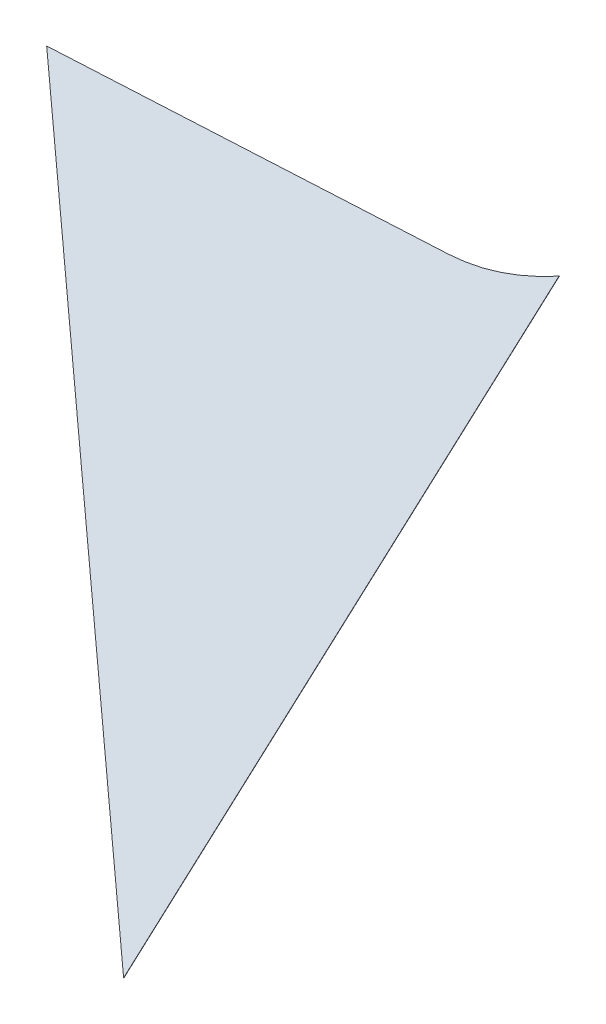
from build123d import *

# Parameters (mm, degrees)
BOSS_EXTRUDE1_DEPTH = 0.0762


with BuildPart() as part:
    # Sketch2 → Boss-Extrude1 (new, symmetric)
    with BuildSketch(Plane(origin=(-105.185567382, -357.647530726, -787.553472376), x_dir=(0.998460453708484, 0.05529862010587779, 0.004334165967541384), z_dir=(0.0455236503809927, -0.7723041093996648, -0.6336197281180407))):
        with BuildLine():
            Line((40.522667634, 66.964251539), (198.132592229, 66.964251539))
            add(Edge.make_bspline(
                [(235, 58.209426309), (217.605890523, 66.964251539), (198.132592229, 66.964251539)],
                knots=[1.104476015, 1.104476015, 1.104476015, 1.570796327, 1.570796327, 1.570796327], degree=2, weights=[1, 0.97294109, 1]))
            Line((235, 58.209426309), (235, 287.108094093))
            Line((235, 287.108094093), (40.522667634, 66.964251539))
        make_face()
    extrude(amount=BOSS_EXTRUDE1_DEPTH, both=True)


solid = part.part
